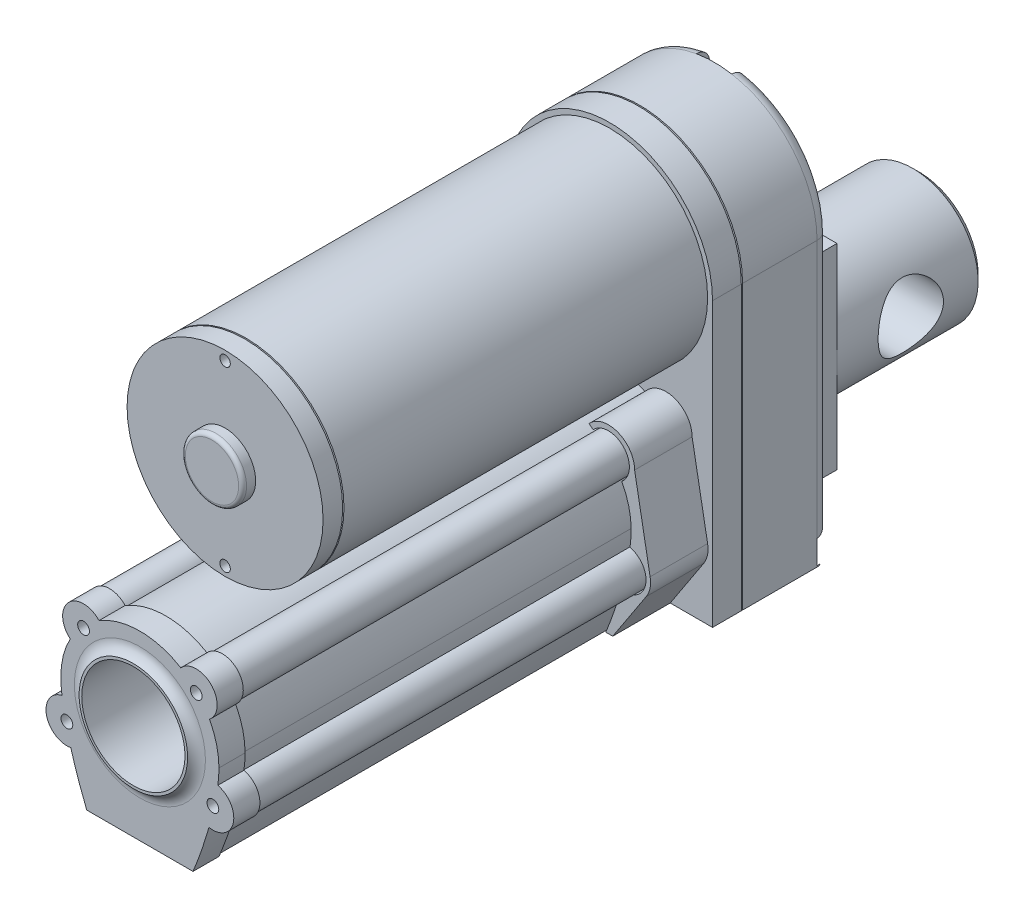
from build123d import *

# Parameters (mm, degrees)
BOSS_EXTRUDE1_DEPTH  = 8.509
BOSS_EXTRUDE3_DEPTH  = 5.588
FILLET1_R            = 2.54
SKETCH6_R            = 19.05
BOSS_EXTRUDE4_DEPTH  = 70.6882
SKETCH9_R            = 3.429
CUT_EXTRUDE1_DEPTH   = 2.54
SKETCH10_R           = 10.033
BOSS_EXTRUDE6_DEPTH  = 86.233
SKETCH12_R           = 10.033
BOSS_EXTRUDE7_DEPTH  = 5.08
SKETCH14_R           = 10.541
SKETCH14_R_2         = 10.033
BOSS_EXTRUDE8_DEPTH  = 1.27
FILLET2_R            = 2.54
SKETCH16_R           = 1.143
CUT_EXTRUDE2_DEPTH   = 17.78
SKETCH17_R           = 1.143
CUT_EXTRUDE3_DEPTH   = 12.7
SKETCH19_R           = 19.05
BOSS_EXTRUDE9_DEPTH  = 3.81
SKETCH20_R           = 5.9436
BOSS_EXTRUDE10_DEPTH = 2.54
FILLET4_R            = 0.762
SKETCH24_R           = 1.016
CUT_EXTRUDE6_DEPTH   = 12.7
BOSS_EXTRUDE12_DEPTH = 11.176
SKETCH26_W           = 25.4
SKETCH26_H           = 38.1
BOSS_EXTRUDE13_DEPTH = 8.636
SKETCH27_R           = 12.7
BOSS_EXTRUDE14_DEPTH = 28.702
SKETCH28_R           = 6.35
CUT_EXTRUDE7_DEPTH   = 14.351
CHAMFER1_SIZE        = 1.27


with BuildPart() as part:
    # Sketch1 → Boss-Extrude1 (new, symmetric)
    with BuildSketch(Plane.XY):
        with BuildLine():
            Line((0, 0), (0, 55.0037))
            ThreePointArc((0, 55.0037), (20.0025, 75.0062), (40.005, 55.0037))
            Line((40.005, 55.0037), (40.005, 0))
            Line((40.005, 0), (0, 0))
        make_face()
    extrude(amount=BOSS_EXTRUDE1_DEPTH, both=True)

    # Fillet1
    fillet1_edges = [part.edges().sort_by_distance(p)[0] for p in [
        (0, 27.50185, -8.509),
        (20.0025, 75.0062, -8.509),
        (40.005, 27.50185, -8.509),
        (20.0025, 0, -8.509),
    ]]
    fillet(fillet1_edges, radius=FILLET1_R)

    # Sketch9 → Cut-Extrude1 (cut)
    with BuildSketch(Plane(origin=(0, 0, -8.509), x_dir=(-1, 0, 0), z_dir=(0, 0, -1))):
        with Locations((-37.465, 2.54)):
            Circle(SKETCH9_R)
        with Locations((-2.54, 2.54)):
            Circle(SKETCH9_R)
        with BuildLine():
            Line((-16.5735, 71.628), (-16.5735, 75.184))
            Line((-16.5735, 75.184), (-23.4315, 75.184))
            Line((-23.4315, 75.184), (-23.4315, 71.628))
            ThreePointArc((-23.4315, 71.628), (-20.0025, 68.199), (-16.5735, 71.628))
        make_face()
    extrude(amount=-CUT_EXTRUDE1_DEPTH, mode=Mode.SUBTRACT)

    # Sketch16 → Cut-Extrude2 (cut)
    with BuildSketch(Plane(origin=(0, 0, -5.969), x_dir=(-1, 0, 0), z_dir=(0, 0, -1))):
        with Locations((-37.465, 2.54)):
            Circle(SKETCH16_R)
        with Locations((-2.54, 2.54)):
            Circle(SKETCH16_R)
        with Locations((-20.0025, 71.628)):
            Circle(SKETCH16_R)
    extrude(amount=-CUT_EXTRUDE2_DEPTH, mode=Mode.SUBTRACT)

    # Sketch26 → Boss-Extrude13 (add)
    with BuildSketch(Plane(origin=(0, 0, -8.509), x_dir=(-1, 0, 0), z_dir=(0, 0, -1))):
        with Locations((-20.0025, 26.199078537)):
            Rectangle(SKETCH26_W, SKETCH26_H)
    extrude(amount=BOSS_EXTRUDE13_DEPTH)

    # Sketch27 → Boss-Extrude14 (add)
    with BuildSketch(Plane(origin=(0, 0, -17.145), x_dir=(-1, 0, 0), z_dir=(0, 0, -1))):
        with Locations((-20.0025, 25.129985574)):
            Circle(SKETCH27_R)
    extrude(amount=BOSS_EXTRUDE14_DEPTH)

    # Sketch28 → Cut-Extrude7 (cut, symmetric)
    with BuildSketch(Plane(origin=(20.0025, 0, 0), x_dir=(0, 0, -1), z_dir=(1, 0, 0))):
        with Locations((31.496, 25.129985574)):
            Circle(SKETCH28_R)
    extrude(amount=CUT_EXTRUDE7_DEPTH, both=True, mode=Mode.SUBTRACT)

    # Chamfer1
    chamfer1_edges = [part.edges().sort_by_distance(p)[0] for p in [
        (32.7025, 25.129985574, -45.847),
    ]]
    chamfer(chamfer1_edges, length=CHAMFER1_SIZE)


with BuildPart() as body_2:
    # Sketch5 → Boss-Extrude3 (new body)
    with BuildSketch(Plane.XY.offset(8.763)):
        with BuildLine():
            Line((0, 0), (0, 55.0037))
            ThreePointArc((0, 55.0037), (20.0025, 75.0062), (40.005, 55.0037))
            Line((40.005, 55.0037), (40.005, 0))
            Line((40.005, 0), (0, 0))
        make_face()
    extrude(amount=BOSS_EXTRUDE3_DEPTH)

    # Sketch6 → Boss-Extrude4 (add)
    with BuildSketch(Plane.XY.offset(14.351)):
        with Locations((20.0025, 55.0037)):
            Circle(SKETCH6_R)
    extrude(amount=BOSS_EXTRUDE4_DEPTH)

    # Sketch10 → Boss-Extrude6 (add)
    with BuildSketch(Plane.XY.offset(14.351)):
        with BuildLine():
            Line((9.8425, 0), (30.1625, 0))
            add(Edge.make_bspline(
                [(30.1625, 0), (31.226301023, 2.609741166), (32.348681597, 5.792679084), (33.255604951, 9.006678218)],
                knots=[0, 0, 0, 0, 0.457098063, 0.457098063, 0.457098063, 0.457098063], degree=3))
            ThreePointArc((33.255604951, 9.006678218), (37.914560546, 11.891774837), (34.871100982, 16.448857634))
            add(Edge.make_bspline(
                [(34.871100982, 16.448857634), (35.01780023, 17.541927309), (35.110432217, 18.623570018), (35.1155, 19.634472975), (35.1155, 19.685)],
                knots=[0.819985001, 0.819985001, 0.819985001, 0.819985001, 0.99099925, 1, 1, 1, 1], degree=3))
            ThreePointArc((35.1155, 19.685), (34.631663976, 23.478458891), (33.211135498, 27.029025958))
            ThreePointArc((33.211135498, 27.029025958), (33.71579816, 32.724378151), (28.002260088, 32.507114004))
            ThreePointArc((28.002260088, 32.507114004), (20.0025, 34.798), (12.002739912, 32.507114004))
            ThreePointArc((12.002739912, 32.507114004), (6.28920184, 32.724378151), (6.793864502, 27.029025958))
            ThreePointArc((6.793864502, 27.029025958), (5.373336024, 23.478458891), (4.8895, 19.685))
            add(Edge.make_bspline(
                [(5.133899018, 16.448857634), (4.98719977, 17.541927309), (4.894567783, 18.623570018), (4.8895, 19.634472975), (4.8895, 19.685)],
                knots=[0.819985001, 0.819985001, 0.819985001, 0.819985001, 0.99099925, 1, 1, 1, 1], degree=3))
            ThreePointArc((5.133899018, 16.448857634), (2.090439454, 11.891774837), (6.749395049, 9.006678218))
            add(Edge.make_bspline(
                [(9.8425, 0), (8.778698977, 2.609741166), (7.656318403, 5.792679084), (6.749395049, 9.006678218)],
                knots=[0, 0, 0, 0, 0.457098063, 0.457098063, 0.457098063, 0.457098063], degree=3))
        make_face()
        with Locations(Location((20.0025, 19.685, 0), (0, 0, 180))):
            Circle(SKETCH10_R, mode=Mode.SUBTRACT)
    extrude(amount=BOSS_EXTRUDE6_DEPTH)

    # Sketch12 → Boss-Extrude7 (add)
    with BuildSketch(Plane.XY.offset(100.584)):
        with BuildLine():
            Line((9.671745512, -0.254), (30.333254488, -0.254))
            add(Edge.make_bspline(
                [(30.333254488, -0.254), (30.631718797, 0.478199517), (30.921565676, 1.213771591), (31.478215598, 2.693934282), (31.746403487, 3.437731975), (32.521886949, 5.679397001), (33.000455536, 7.186360703), (33.434596649, 8.707064076)],
                knots=[0, 0, 0, 0, 0.25, 0.25, 0.5, 0.5, 1, 1, 1, 1], degree=3))
            ThreePointArc((33.434596649, 8.707064076), (38.163303677, 11.840310383), (35.153400776, 16.648468772))
            add(Edge.make_bspline(
                [(35.153400776, 16.648468772), (35.281920122, 17.655861208), (35.3695, 18.66928999), (35.3695, 19.685)],
                knots=[0, 0, 0, 0, 1, 1, 1, 1], degree=3))
            ThreePointArc((35.3695, 19.685), (34.904493115, 23.436704972), (33.537614766, 26.961356043))
            ThreePointArc((33.537614766, 26.961356043), (33.899869276, 32.899403361), (27.951114087, 32.836586334))
            ThreePointArc((27.951114087, 32.836586334), (20.0025, 35.052), (12.053885913, 32.836586334))
            ThreePointArc((12.053885913, 32.836586334), (6.105130724, 32.899403361), (6.467385234, 26.961356043))
            ThreePointArc((6.467385234, 26.961356043), (5.100506885, 23.436704972), (4.6355, 19.685))
            add(Edge.make_bspline(
                [(4.6355, 19.685), (4.6355, 18.669373414), (4.723086167, 17.655811912), (4.851599224, 16.648468772)],
                knots=[0, 0, 0, 0, 1, 1, 1, 1], degree=3))
            ThreePointArc((4.851599224, 16.648468772), (1.841696323, 11.840310383), (6.570403351, 8.707064076))
            add(Edge.make_bspline(
                [(6.570403351, 8.707064076), (7.004535994, 7.186390371), (7.483291477, 5.67885043), (8.258789857, 3.437188492), (8.526975821, 2.693416931), (9.083468541, 1.213688966), (9.37327892, 0.478205116), (9.671745512, -0.254)],
                knots=[0, 0, 0, 0, 0.5, 0.5, 0.75, 0.75, 1, 1, 1, 1], degree=3))
        make_face()
        with Locations(Location((20.0025, 19.685, 0), (0, 0, 180))):
            Circle(SKETCH12_R, mode=Mode.SUBTRACT)
    extrude(amount=BOSS_EXTRUDE7_DEPTH)

    # Sketch14 → Boss-Extrude8 (add)
    with BuildSketch(Plane.XY.offset(105.664)):
        with Locations((20.0025, 19.685)):
            Circle(SKETCH14_R)
        with Locations(Location((20.0025, 19.685, 0), (0, 0, 180))):
            Circle(SKETCH14_R_2, mode=Mode.SUBTRACT)
    extrude(amount=BOSS_EXTRUDE8_DEPTH)

    # Fillet2
    # the kernel refuses this fillet: 2.54 mm, written as the material it adds along each edge
    with BuildSketch(Plane(origin=(20.0025, 19.685, 105.664), x_dir=(1, 0, 0), z_dir=(0, -1, 0))) as fillet2_piece_1:
        with BuildLine():
            CenterArc((12.740704526, 2.54), FILLET2_R, 210, 60)
            Line((10.541, 1.27), (10.497005909, 1.2446))
            ThreePointArc((10.497005909, 1.2446), (10.4902, 0.635), (10.4902, 0))
            Line((10.4902, 0), (10.541, -0.0508))
            Line((10.541, -0.0508), (12.740704526, -0.0508))
            Line((12.740704526, -0.0508), (12.740704526, 0))
        make_face()
    revolve(axis=Axis((20.0025, 19.685, 105.664), (0, 0, 1)))

    # Sketch17 → Cut-Extrude3 (cut)
    with BuildSketch(Plane.XY.offset(105.664)):
        with Locations((30.954731416, 30.099)):
            Circle(SKETCH17_R)
        with Locations((34.19127274, 12.7)):
            Circle(SKETCH17_R)
        with Locations((5.81372726, 12.7)):
            Circle(SKETCH17_R)
        with Locations((9.050268584, 30.099)):
            Circle(SKETCH17_R)
    extrude(amount=-CUT_EXTRUDE3_DEPTH, mode=Mode.SUBTRACT)


with BuildPart() as body_3:
    # Sketch19 → Boss-Extrude9 (new body)
    with BuildSketch(Plane.XY.offset(85.2932)):
        with Locations(Location((20.0025, 55.0037, 0), (0, 0, 180))):
            Circle(SKETCH19_R)
    extrude(amount=BOSS_EXTRUDE9_DEPTH)

    # Sketch20 → Boss-Extrude10 (add)
    with BuildSketch(Plane.XY.offset(89.1032)):
        with Locations((20.0025, 55.0037)):
            Circle(SKETCH20_R)
    extrude(amount=BOSS_EXTRUDE10_DEPTH)

    # Fillet4
    fillet4_edges = [body_3.edges().sort_by_distance(p)[0] for p in [
        (14.0589, 55.0037, 91.6432),
    ]]
    fillet(fillet4_edges, radius=FILLET4_R)


with BuildPart() as cut_extrude6_tool:
    # Sketch24 → Cut-Extrude6 (new body)
    with BuildSketch(Plane.XY.offset(89.1032)):
        with Locations((20.0025, 72.2757)):
            Circle(SKETCH24_R)
        with Locations((20.0025, 37.7317)):
            Circle(SKETCH24_R)
    extrude(amount=-CUT_EXTRUDE6_DEPTH)


with BuildPart() as body_2_1:
    add(body_2.part)

    # Cut-Extrude6: cut by cut_extrude6_tool
    add(cut_extrude6_tool.part, mode=Mode.SUBTRACT)

    # Sketch25 → Boss-Extrude12 (add)
    with BuildSketch(Plane.XY.offset(14.351)):
        with BuildLine():
            Line((30.436716454, 0), (31.779066596, 0))
            Line((31.779066596, 0), (38.298643843, 9.937971032))
            ThreePointArc((38.298643843, 9.937971032), (39.030059315, 11.716403864), (39.048039076, 13.639284166))
            Line((39.048039076, 13.639284166), (36.034731416, 30.099))
            ThreePointArc((36.034731416, 30.099), (32.778037303, 34.840514067), (27.183567777, 33.502634059))
            Line((27.183567777, 33.502634059), (27.9721266, 32.859464546))
            ThreePointArc((27.9721266, 32.859464546), (33.910550303, 32.88812723), (33.537614766, 26.961356043))
            ThreePointArc((33.537614766, 26.961356043), (34.905666392, 23.432041565), (35.36949699, 19.675382529))
            add(Edge.make_bspline(
                [(35.141757719, 16.651287677), (35.209594995, 17.166732711), (35.324312915, 18.235415469), (35.367366892, 19.183665047), (35.36949699, 19.675382529)],
                knots=[0.832741148, 0.832741148, 0.832741148, 0.832741148, 0.916061435, 1, 1, 1, 1], degree=3))
            ThreePointArc((35.141757719, 16.651287677), (38.164566417, 11.846165488), (33.434596651, 8.707064075))
            add(Edge.make_bspline(
                [(30.436716454, 0), (30.556187885, 0.294225535), (30.801789429, 0.910185259), (31.318228851, 2.25405184), (31.97439215, 4.065716636), (32.735995342, 6.352630652), (33.210644319, 7.922607002), (33.434596651, 8.707064075)],
                knots=[0.005460213, 0.005460213, 0.005460213, 0.005460213, 0.055774623, 0.111549246, 0.223098493, 0.334647739, 0.446196986, 0.446196986, 0.446196986, 0.446196986], degree=3))
        make_face()
        with BuildLine():
            Line((8.225933404, 0), (9.568283546, 0))
            add(Edge.make_bspline(
                [(9.568283546, 0), (9.448812115, 0.294225535), (9.203210571, 0.910185259), (8.686771149, 2.25405184), (8.03060785, 4.065716636), (7.269004658, 6.352630652), (6.794355681, 7.922607002), (6.570403349, 8.707064075)],
                knots=[0.005460213, 0.005460213, 0.005460213, 0.005460213, 0.055774623, 0.111549246, 0.223098493, 0.334647739, 0.446196986, 0.446196986, 0.446196986, 0.446196986], degree=3))
            ThreePointArc((6.570403349, 8.707064075), (1.840365092, 11.84648427), (4.863876319, 16.651440141))
            add(Edge.make_bspline(
                [(4.863876319, 16.651440141), (4.795376218, 17.170454447), (4.679968352, 18.243534458), (4.636755225, 19.195289273), (4.634625126, 19.687006754)],
                knots=[0.83212287, 0.83212287, 0.83212287, 0.83212287, 0.916061435, 1, 1, 1, 1], degree=3))
            ThreePointArc((4.634625126, 19.687006754), (5.09992452, 23.437975646), (6.466696616, 26.961923034))
            ThreePointArc((6.466696616, 26.961923034), (6.094755807, 32.888451599), (12.0328734, 32.859464546))
            Line((12.0328734, 32.859464546), (12.821432223, 33.502634059))
            ThreePointArc((12.821432223, 33.502634059), (7.226962697, 34.840514067), (3.970268584, 30.099))
            Line((3.970268584, 30.099), (0.956960924, 13.639284166))
            ThreePointArc((0.956960924, 13.639284166), (0.974940685, 11.716403864), (1.706356157, 9.937971032))
            Line((1.706356157, 9.937971032), (8.225933404, 0))
        make_face()
    extrude(amount=BOSS_EXTRUDE12_DEPTH)


with BuildPart() as body_3_1:
    add(body_3.part)

    # Cut-Extrude6: cut by cut_extrude6_tool
    add(cut_extrude6_tool.part, mode=Mode.SUBTRACT)


solid = Compound([part.part, body_2_1.part, body_3_1.part])
